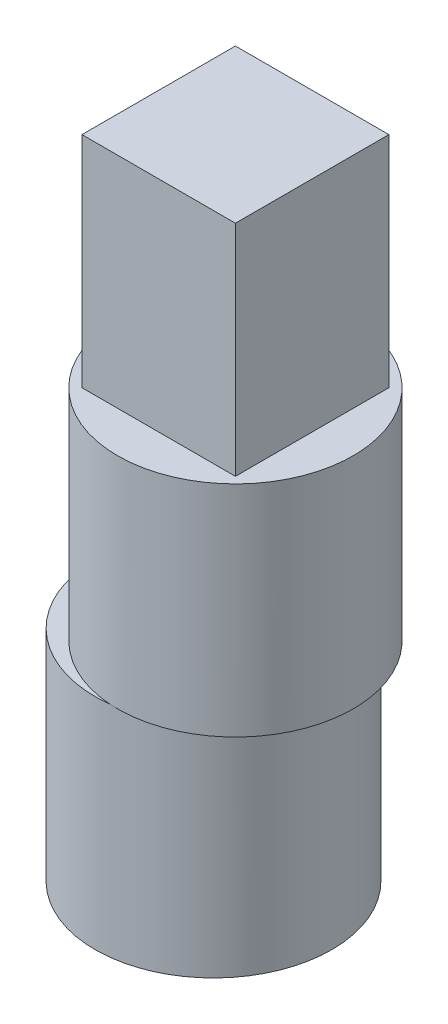
from build123d import *

# Parameters (mm, degrees)
SKIZZE1_R                       = 5.375
AUFSATZ_LINEAR_AUSTRAGEN1_DEPTH = 10
SKIZZE3_R                       = 5.4
AUFSATZ_LINEAR_AUSTRAGEN3_DEPTH = 10
SKIZZE4_W                       = 7
SKIZZE4_H                       = 7
AUFSATZ_LINEAR_AUSTRAGEN4_DEPTH = 10


with BuildPart() as part:
    # Skizze1 → Aufsatz-Linear austragen1 (new body)
    with BuildSketch(Plane(origin=(0, 0, 0), x_dir=(1, 0, 0), z_dir=(0, 1, 0))):
        Circle(SKIZZE1_R)
    extrude(amount=AUFSATZ_LINEAR_AUSTRAGEN1_DEPTH)

    # Skizze3 → Aufsatz-Linear austragen3 (add)
    with BuildSketch(Plane(origin=(0, 0, 0), x_dir=(-1, 0, 0), z_dir=(0, -1, 0))):
        with Locations((1, 0)):
            Circle(SKIZZE3_R)
    extrude(amount=AUFSATZ_LINEAR_AUSTRAGEN3_DEPTH)

    # Skizze4 → Aufsatz-Linear austragen4 (add)
    with BuildSketch(Plane(origin=(0, 10, 0), x_dir=(1, 0, 0), z_dir=(0, 1, 0))):
        Rectangle(SKIZZE4_W, SKIZZE4_H)
    extrude(amount=AUFSATZ_LINEAR_AUSTRAGEN4_DEPTH)


solid = part.part
